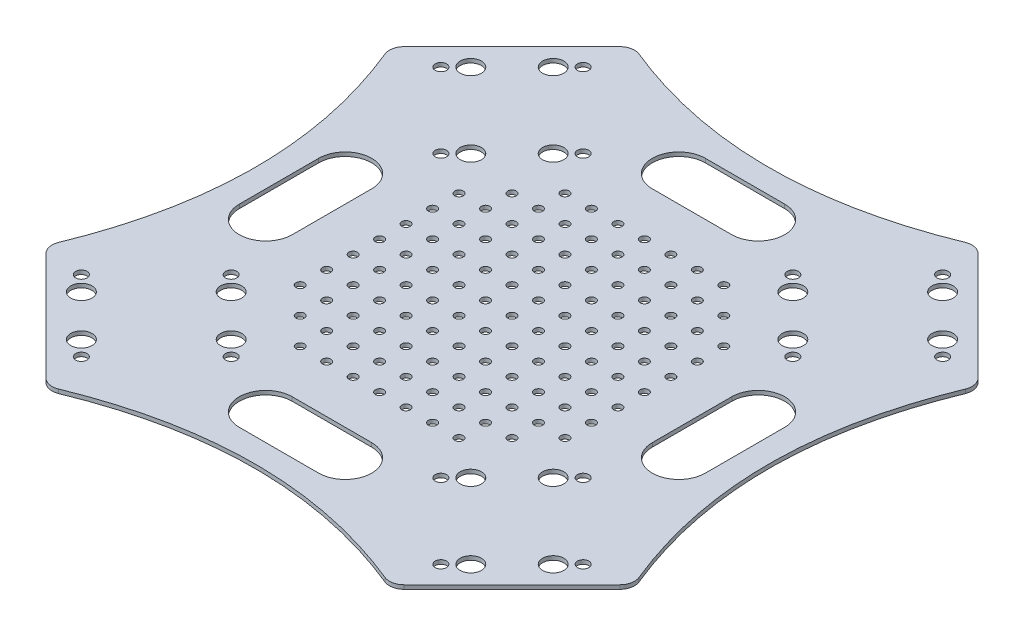
from build123d import *

# Parameters (mm, degrees)
DODANIE_WYCI_GNI_CIE1_DEPTH       = 1.5
ZAOKR_GLENIE1_R                   = 5.5
SZKIC2_R                          = 2.15
SZKIC2_R_2                        = 4
WYTNIJ_WYCI_GNI_CIE1_DEPTH        = 156.56996864
SZYK_KO_OWY1_COUNT                = 4
WYTNIJ_WYCI_GNI_CIE2_REACH        = 157.57
SZYK_KO_OWY2_COUNT                = 4
WYTNIJ_WYCI_GNI_CIE3_REACH        = 157.57
SZKIC4_R                          = 1.6
SZYK_LINIOWY1_COUNT               = 5
SZYK_LINIOWY1_PITCH               = 10
SZYK_LINIOWY1_COUNT_DIR2          = 5
SZYK_LINIOWY1_PITCH_DIR2          = 10
SZYK_KO_OWY3_OUTLINE_R            = 1.6
SZYK_KO_OWY3_DEPTH                = 1.5
SZYK_LINIOWY2_COUNT               = 2
SZYK_LINIOWY2_PITCH               = 50
SZYK_LINIOWY3_COPY_1_REACH        = 157.57
SZYK_LINIOWY3_COPY_1_SKETCH_R     = 1.6
SZYK_LINIOWY3_COPY_2_REACH        = 157.57
SZYK_LINIOWY3_COPY_2_SKETCH_R     = 1.6
SZYK_LINIOWY3_COPY_3_REACH        = 157.57
SZYK_LINIOWY3_COPY_3_SKETCH_R     = 1.6
SZYK_LINIOWY3_COL_COPY_1_REACH    = 157.57
SZYK_LINIOWY3_COL_COPY_1_SKETCH_R = 1.6
SZYK_LINIOWY3_COL_COPY_2_REACH    = 157.57
SZYK_LINIOWY3_COL_COPY_2_SKETCH_R = 1.6
SZYK_LINIOWY3_COL_COPY_3_REACH    = 157.57
SZYK_LINIOWY3_COL_COPY_3_SKETCH_R = 1.6
SZYK_KO_OWY4_COPY_1_REACH         = 157.57
SZYK_KO_OWY4_COPY_1_SKETCH_R      = 1.6
SZYK_KO_OWY4_COPY_2_REACH         = 157.57
SZYK_KO_OWY4_COPY_2_SKETCH_R      = 1.6
SZYK_KO_OWY4_COPY_3_REACH         = 157.57
SZYK_KO_OWY4_COPY_3_SKETCH_R      = 1.6
SZYK_KO_OWY4_COPY_4_REACH         = 157.57
SZYK_KO_OWY4_COPY_4_SKETCH_R      = 1.6
SZYK_KO_OWY4_COPY_5_REACH         = 157.57
SZYK_KO_OWY4_COPY_5_SKETCH_R      = 1.6
SZYK_KO_OWY4_COPY_6_REACH         = 157.57
SZYK_KO_OWY4_COPY_6_SKETCH_R      = 1.6
SZYK_KO_OWY4_COPY_7_REACH         = 157.57
SZYK_KO_OWY4_COPY_7_SKETCH_R      = 1.6
SZYK_KO_OWY4_COPY_8_REACH         = 157.57
SZYK_KO_OWY4_COPY_8_SKETCH_R      = 1.6
SZYK_KO_OWY4_COPY_9_REACH         = 157.57
SZYK_KO_OWY4_COPY_9_SKETCH_R      = 1.6
SZYK_KO_OWY4_COPY_10_REACH        = 157.57
SZYK_KO_OWY4_COPY_10_SKETCH_R     = 1.6
SZYK_KO_OWY4_COPY_11_REACH        = 157.57
SZYK_KO_OWY4_COPY_11_SKETCH_R     = 1.6
SZYK_KO_OWY4_COPY_12_REACH        = 157.57
SZYK_KO_OWY4_COPY_12_SKETCH_R     = 1.6
SZYK_KO_OWY4_COPY_13_REACH        = 157.57
SZYK_KO_OWY4_COPY_13_SKETCH_R     = 1.6
SZYK_KO_OWY4_COPY_14_REACH        = 157.57
SZYK_KO_OWY4_COPY_14_SKETCH_R     = 1.6
SZYK_KO_OWY4_COPY_15_REACH        = 157.57
SZYK_KO_OWY4_COPY_15_SKETCH_R     = 1.6
SZYK_KO_OWY4_COPY_16_REACH        = 157.57
SZYK_KO_OWY4_COPY_16_SKETCH_R     = 1.6
SZYK_KO_OWY4_COPY_17_REACH        = 157.57
SZYK_KO_OWY4_COPY_17_SKETCH_R     = 1.6
SZYK_KO_OWY4_COPY_18_REACH        = 157.57
SZYK_KO_OWY4_COPY_18_SKETCH_R     = 1.6
SZYK_KO_OWY4_COPY_19_REACH        = 157.57
SZYK_KO_OWY4_COPY_19_SKETCH_R     = 1.6
SZYK_KO_OWY4_COPY_20_REACH        = 157.57
SZYK_KO_OWY4_COPY_20_SKETCH_R     = 1.6
SZYK_KO_OWY4_COPY_21_REACH        = 157.57
SZYK_KO_OWY4_COPY_21_SKETCH_R     = 1.6


# Read off the part's stored shape, not the designer's step: Szyk kołowy3
with BuildPart() as part:
    # Szkic1 → Dodanie-wyciągnięcie1 (new body)
    with BuildSketch(Plane(origin=(0, 0, 0), x_dir=(1, 0, 0), z_dir=(0, 1, 0))):
        with BuildLine():
            Line((-65, -111), (-111, -65))
            add(Edge.make_bspline(
                [(-111, 65), (-83, 0), (-111, -65)],
                knots=[0, 0, 0, 1, 1, 1], degree=2))
            Line((-111, 65), (-65, 111))
            add(Edge.make_bspline(
                [(65, 111), (0, 83), (-65, 111)],
                knots=[0, 0, 0, 1, 1, 1], degree=2))
            Line((65, 111), (111, 65))
            add(Edge.make_bspline(
                [(111, -65), (83, 0), (111, 65)],
                knots=[0, 0, 0, 1, 1, 1], degree=2))
            Line((111, -65), (65, -111))
            add(Edge.make_bspline(
                [(-65, -111), (0, -83), (65, -111)],
                knots=[0, 0, 0, 1, 1, 1], degree=2))
        make_face()
    extrude(amount=DODANIE_WYCI_GNI_CIE1_DEPTH)

    # Zaokrąglenie1
    zaokr_glenie1_edges = [part.edges().sort_by_distance(p)[0] for p in [
        (-111, 0.75, -65),
        (-65, 0.75, -111),
        (65, 0.75, -111),
        (111, 0.75, -65),
        (111, 0.75, 65),
        (65, 0.75, 111),
        (-111, 0.75, 65),
        (-65, 0.75, 111),
    ]]
    fillet(zaokr_glenie1_edges, radius=ZAOKR_GLENIE1_R)

    # Szkic2 → Wytnij-wyciągnięcie1 (cut, through all)
    with BuildSketch(Plane(origin=(0, 1.5, 0), x_dir=(1, 0, 0), z_dir=(0, 1, 0))):
        with Locations(Location((-67.882250994, -94.752308679, 0), (0, 0, 270))):
            Circle(SZKIC2_R)
        with Locations(Location((-94.752308679, -67.882250994, 0), (0, 0, 90))):
            Circle(SZKIC2_R)
        with Locations(Location((-39.597979746, -66.468037432, 0), (0, 0, 90))):
            Circle(SZKIC2_R)
        with Locations(Location((-66.468037432, -39.597979746, 0), (0, 0, 270))):
            Circle(SZKIC2_R)
        with Locations(Location((-73.539105243, -89.09545443, 0), (0, 0, 270))):
            Circle(SZKIC2_R_2)
        with Locations(Location((-89.09545443, -73.539105243, 0), (0, 0, 90))):
            Circle(SZKIC2_R_2)
        with Locations(Location((-60.811183182, -45.254833996, 0), (0, 0, 270))):
            Circle(SZKIC2_R_2)
        with Locations(Location((-45.254833996, -60.811183182, 0), (0, 0, 90))):
            Circle(SZKIC2_R_2)
    wytnij_wyci_gni_cie1 = extrude(amount=-WYTNIJ_WYCI_GNI_CIE1_DEPTH, mode=Mode.SUBTRACT)

    # Szyk kołowy1: Wytnij-wyciągnięcie1 ×4 about axis
    szyk_ko_owy1_axis = Axis((0, 0, 0), (0, 1, 0))
    for i in range(1, SZYK_KO_OWY1_COUNT):
        add(wytnij_wyci_gni_cie1.rotate(szyk_ko_owy1_axis, i * 360 / SZYK_KO_OWY1_COUNT), mode=Mode.SUBTRACT)

    # Szkic3 → Wytnij-wyciągnięcie2 (cut, up to next)
    with BuildSketch(Plane(origin=(0, 1.5, 0), x_dir=(1, 0, 0), z_dir=(0, 1, 0)), mode=Mode.PRIVATE) as wytnij_wyci_gni_cie2_sk1:
        with BuildLine():
            Line((-15, 88), (15, 88))
            ThreePointArc((15, 88), (25, 78), (15, 68))
            Line((15, 68), (-15, 68))
            ThreePointArc((-15, 68), (-25, 78), (-15, 88))
        make_face()
    wytnij_wyci_gni_cie2_tool1 = extrude(wytnij_wyci_gni_cie2_sk1.sketch, amount=-WYTNIJ_WYCI_GNI_CIE2_REACH, mode=Mode.PRIVATE) & part.part
    wytnij_wyci_gni_cie2 = wytnij_wyci_gni_cie2_tool1.solids().sort_by_distance((0, 1.5, -78))[0]
    add(wytnij_wyci_gni_cie2, mode=Mode.SUBTRACT)

    # Szyk kołowy2: Wytnij-wyciągnięcie2 ×4 about axis
    szyk_ko_owy2_axis = Axis((0, 0, 0), (0, 1, 0))
    for i in range(1, SZYK_KO_OWY2_COUNT):
        add(wytnij_wyci_gni_cie2.rotate(szyk_ko_owy2_axis, i * 360 / SZYK_KO_OWY2_COUNT), mode=Mode.SUBTRACT)

    # Szkic4 → Wytnij-wyciągnięcie3 (cut, up to next)
    with BuildSketch(Plane(origin=(0, 1.5, 0), x_dir=(1, 0, 0), z_dir=(0, 1, 0)), mode=Mode.PRIVATE) as wytnij_wyci_gni_cie3_sk1:
        with Locations(Location((0, 0, 0), (0, 0, 270))):
            Circle(SZKIC4_R)
    wytnij_wyci_gni_cie3_tool1 = extrude(wytnij_wyci_gni_cie3_sk1.sketch, amount=-WYTNIJ_WYCI_GNI_CIE3_REACH, mode=Mode.PRIVATE) & part.part
    wytnij_wyci_gni_cie3 = wytnij_wyci_gni_cie3_tool1.solids().sort_by_distance((0, 1.5, 0))[0]
    add(wytnij_wyci_gni_cie3, mode=Mode.SUBTRACT)

    # Szyk liniowy1: Wytnij-wyci_gni_cie3 5 × 5
    with Locations(*[(i * SZYK_LINIOWY1_PITCH, 0, j * SZYK_LINIOWY1_PITCH_DIR2) for i in range(SZYK_LINIOWY1_COUNT) for j in range(SZYK_LINIOWY1_COUNT_DIR2) if (i, j) != (0, 0)]):
        add(wytnij_wyci_gni_cie3, mode=Mode.SUBTRACT)

    # Szyk kołowy3 outline → Szyk kołowy3 (cut)
    with BuildSketch(Plane(origin=(0, 0, 0), x_dir=(1, 0, 0), z_dir=(0, 1, 0))):
        with Locations((0, 40)):
            Circle(SZYK_KO_OWY3_OUTLINE_R)
        with Locations((40, 30)):
            Circle(SZYK_KO_OWY3_OUTLINE_R)
        with Locations((30, 30)):
            Circle(SZYK_KO_OWY3_OUTLINE_R)
        with Locations((20, 30)):
            Circle(SZYK_KO_OWY3_OUTLINE_R)
        with Locations((10, 40)):
            Circle(SZYK_KO_OWY3_OUTLINE_R)
        with Locations((20, 40)):
            Circle(SZYK_KO_OWY3_OUTLINE_R)
        with Locations((30, 40)):
            Circle(SZYK_KO_OWY3_OUTLINE_R)
        with Locations((40, 40)):
            Circle(SZYK_KO_OWY3_OUTLINE_R)
        with Locations((0, 10)):
            Circle(SZYK_KO_OWY3_OUTLINE_R)
        with Locations((10, 10)):
            Circle(SZYK_KO_OWY3_OUTLINE_R)
        with Locations((20, 10)):
            Circle(SZYK_KO_OWY3_OUTLINE_R)
        with Locations((30, 10)):
            Circle(SZYK_KO_OWY3_OUTLINE_R)
        with Locations((10, 30)):
            Circle(SZYK_KO_OWY3_OUTLINE_R)
        with Locations((0, 30)):
            Circle(SZYK_KO_OWY3_OUTLINE_R)
        with Locations((40, 20)):
            Circle(SZYK_KO_OWY3_OUTLINE_R)
        with Locations((30, 20)):
            Circle(SZYK_KO_OWY3_OUTLINE_R)
        with Locations((40, 10)):
            Circle(SZYK_KO_OWY3_OUTLINE_R)
        with Locations((0, 20)):
            Circle(SZYK_KO_OWY3_OUTLINE_R)
        with Locations((10, 20)):
            Circle(SZYK_KO_OWY3_OUTLINE_R)
        with Locations((20, 20)):
            Circle(SZYK_KO_OWY3_OUTLINE_R)
        with Locations((-40, 0)):
            Circle(SZYK_KO_OWY3_OUTLINE_R)
        with Locations((-30, 40)):
            Circle(SZYK_KO_OWY3_OUTLINE_R)
        with Locations((-30, 30)):
            Circle(SZYK_KO_OWY3_OUTLINE_R)
        with Locations((-30, 20)):
            Circle(SZYK_KO_OWY3_OUTLINE_R)
        with Locations((-40, 10)):
            Circle(SZYK_KO_OWY3_OUTLINE_R)
        with Locations((-40, 20)):
            Circle(SZYK_KO_OWY3_OUTLINE_R)
        with Locations((-40, 30)):
            Circle(SZYK_KO_OWY3_OUTLINE_R)
        with Locations((-40, 40)):
            Circle(SZYK_KO_OWY3_OUTLINE_R)
        with Locations((-10, 0)):
            Circle(SZYK_KO_OWY3_OUTLINE_R)
        with Locations((-10, 10)):
            Circle(SZYK_KO_OWY3_OUTLINE_R)
        with Locations((-10, 20)):
            Circle(SZYK_KO_OWY3_OUTLINE_R)
        with Locations((-10, 30)):
            Circle(SZYK_KO_OWY3_OUTLINE_R)
        with Locations((-30, 10)):
            Circle(SZYK_KO_OWY3_OUTLINE_R)
        with Locations((-30, 0)):
            Circle(SZYK_KO_OWY3_OUTLINE_R)
        with Locations((-20, 40)):
            Circle(SZYK_KO_OWY3_OUTLINE_R)
        with Locations((-20, 30)):
            Circle(SZYK_KO_OWY3_OUTLINE_R)
        with Locations((-10, 40)):
            Circle(SZYK_KO_OWY3_OUTLINE_R)
        with Locations((-20, 0)):
            Circle(SZYK_KO_OWY3_OUTLINE_R)
        with Locations((-20, 10)):
            Circle(SZYK_KO_OWY3_OUTLINE_R)
        with Locations((-20, 20)):
            Circle(SZYK_KO_OWY3_OUTLINE_R)
        with Locations((-40, -30)):
            Circle(SZYK_KO_OWY3_OUTLINE_R)
        with Locations((-30, -30)):
            Circle(SZYK_KO_OWY3_OUTLINE_R)
        with Locations((-20, -30)):
            Circle(SZYK_KO_OWY3_OUTLINE_R)
        with Locations((-10, -40)):
            Circle(SZYK_KO_OWY3_OUTLINE_R)
        with Locations((-20, -40)):
            Circle(SZYK_KO_OWY3_OUTLINE_R)
        with Locations((-30, -40)):
            Circle(SZYK_KO_OWY3_OUTLINE_R)
        with Locations((-40, -40)):
            Circle(SZYK_KO_OWY3_OUTLINE_R)
        with Locations((-10, -10)):
            Circle(SZYK_KO_OWY3_OUTLINE_R)
        with Locations((-20, -10)):
            Circle(SZYK_KO_OWY3_OUTLINE_R)
        with Locations((-30, -10)):
            Circle(SZYK_KO_OWY3_OUTLINE_R)
        with Locations((-10, -30)):
            Circle(SZYK_KO_OWY3_OUTLINE_R)
        with Locations((-40, -20)):
            Circle(SZYK_KO_OWY3_OUTLINE_R)
        with Locations((-30, -20)):
            Circle(SZYK_KO_OWY3_OUTLINE_R)
        with Locations((-40, -10)):
            Circle(SZYK_KO_OWY3_OUTLINE_R)
        with Locations((-10, -20)):
            Circle(SZYK_KO_OWY3_OUTLINE_R)
        with Locations((-20, -20)):
            Circle(SZYK_KO_OWY3_OUTLINE_R)
    extrude(amount=SZYK_KO_OWY3_DEPTH, mode=Mode.SUBTRACT)

    # Szyk liniowy2: Wytnij-wyciągnięcie3 ×2
    with Locations(*[(0, 0, i * SZYK_LINIOWY2_PITCH) for i in range(1, SZYK_LINIOWY2_COUNT)]):
        add(wytnij_wyci_gni_cie3, mode=Mode.SUBTRACT)

    # Szyk liniowy3 copy 1 sketch → Szyk liniowy3 copy 1 (cut, up to next)
    with BuildSketch(Plane(origin=(10, 1.5, 50), x_dir=(1, 0, 0), z_dir=(0, 1, 0)), mode=Mode.PRIVATE) as szyk_liniowy3_copy_1_sk1:
        with Locations(Location((0, 0, 0), (0, 0, 270))):
            Circle(SZYK_LINIOWY3_COPY_1_SKETCH_R)
    szyk_liniowy3_copy_1_tool1 = extrude(szyk_liniowy3_copy_1_sk1.sketch, amount=-SZYK_LINIOWY3_COPY_1_REACH, mode=Mode.PRIVATE) & part.part
    add(szyk_liniowy3_copy_1_tool1.solids().sort_by_distance((10, 1.5, 50))[0], mode=Mode.SUBTRACT)

    # Szyk liniowy3 copy 2 sketch → Szyk liniowy3 copy 2 (cut, up to next)
    with BuildSketch(Plane(origin=(20, 1.5, 50), x_dir=(1, 0, 0), z_dir=(0, 1, 0)), mode=Mode.PRIVATE) as szyk_liniowy3_copy_2_sk1:
        with Locations(Location((0, 0, 0), (0, 0, 270))):
            Circle(SZYK_LINIOWY3_COPY_2_SKETCH_R)
    szyk_liniowy3_copy_2_tool1 = extrude(szyk_liniowy3_copy_2_sk1.sketch, amount=-SZYK_LINIOWY3_COPY_2_REACH, mode=Mode.PRIVATE) & part.part
    add(szyk_liniowy3_copy_2_tool1.solids().sort_by_distance((20, 1.5, 50))[0], mode=Mode.SUBTRACT)

    # Szyk liniowy3 copy 3 sketch → Szyk liniowy3 copy 3 (cut, up to next)
    with BuildSketch(Plane(origin=(30, 1.5, 50), x_dir=(1, 0, 0), z_dir=(0, 1, 0)), mode=Mode.PRIVATE) as szyk_liniowy3_copy_3_sk1:
        with Locations(Location((0, 0, 0), (0, 0, 270))):
            Circle(SZYK_LINIOWY3_COPY_3_SKETCH_R)
    szyk_liniowy3_copy_3_tool1 = extrude(szyk_liniowy3_copy_3_sk1.sketch, amount=-SZYK_LINIOWY3_COPY_3_REACH, mode=Mode.PRIVATE) & part.part
    add(szyk_liniowy3_copy_3_tool1.solids().sort_by_distance((30, 1.5, 50))[0], mode=Mode.SUBTRACT)

    # Szyk liniowy3 col copy 1 sketch → Szyk liniowy3 col copy 1 (cut, up to next)
    with BuildSketch(Plane(origin=(-10, 1.5, 50), x_dir=(1, 0, 0), z_dir=(0, 1, 0)), mode=Mode.PRIVATE) as szyk_liniowy3_col_copy_1_sk1:
        with Locations(Location((0, 0, 0), (0, 0, 270))):
            Circle(SZYK_LINIOWY3_COL_COPY_1_SKETCH_R)
    szyk_liniowy3_col_copy_1_tool1 = extrude(szyk_liniowy3_col_copy_1_sk1.sketch, amount=-SZYK_LINIOWY3_COL_COPY_1_REACH, mode=Mode.PRIVATE) & part.part
    add(szyk_liniowy3_col_copy_1_tool1.solids().sort_by_distance((-10, 1.5, 50))[0], mode=Mode.SUBTRACT)

    # Szyk liniowy3 col copy 2 sketch → Szyk liniowy3 col copy 2 (cut, up to next)
    with BuildSketch(Plane(origin=(-20, 1.5, 50), x_dir=(1, 0, 0), z_dir=(0, 1, 0)), mode=Mode.PRIVATE) as szyk_liniowy3_col_copy_2_sk1:
        with Locations(Location((0, 0, 0), (0, 0, 270))):
            Circle(SZYK_LINIOWY3_COL_COPY_2_SKETCH_R)
    szyk_liniowy3_col_copy_2_tool1 = extrude(szyk_liniowy3_col_copy_2_sk1.sketch, amount=-SZYK_LINIOWY3_COL_COPY_2_REACH, mode=Mode.PRIVATE) & part.part
    add(szyk_liniowy3_col_copy_2_tool1.solids().sort_by_distance((-20, 1.5, 50))[0], mode=Mode.SUBTRACT)

    # Szyk liniowy3 col copy 3 sketch → Szyk liniowy3 col copy 3 (cut, up to next)
    with BuildSketch(Plane(origin=(-30, 1.5, 50), x_dir=(1, 0, 0), z_dir=(0, 1, 0)), mode=Mode.PRIVATE) as szyk_liniowy3_col_copy_3_sk1:
        with Locations(Location((0, 0, 0), (0, 0, 270))):
            Circle(SZYK_LINIOWY3_COL_COPY_3_SKETCH_R)
    szyk_liniowy3_col_copy_3_tool1 = extrude(szyk_liniowy3_col_copy_3_sk1.sketch, amount=-SZYK_LINIOWY3_COL_COPY_3_REACH, mode=Mode.PRIVATE) & part.part
    add(szyk_liniowy3_col_copy_3_tool1.solids().sort_by_distance((-30, 1.5, 50))[0], mode=Mode.SUBTRACT)

    # Szyk kołowy4 copy 1 sketch → Szyk kołowy4 copy 1 (cut, up to next)
    with BuildSketch(Plane(origin=(50, 1.5, 0), x_dir=(0, 0, -1), z_dir=(0, 1, 0)), mode=Mode.PRIVATE) as szyk_ko_owy4_copy_1_sk1:
        with Locations(Location((0, 0, 0), (0, 0, 270))):
            Circle(SZYK_KO_OWY4_COPY_1_SKETCH_R)
    szyk_ko_owy4_copy_1_tool1 = extrude(szyk_ko_owy4_copy_1_sk1.sketch, amount=-SZYK_KO_OWY4_COPY_1_REACH, mode=Mode.PRIVATE) & part.part
    add(szyk_ko_owy4_copy_1_tool1.solids().sort_by_distance((50, 1.5, 0))[0], mode=Mode.SUBTRACT)

    # Szyk kołowy4 copy 2 sketch → Szyk kołowy4 copy 2 (cut, up to next)
    with BuildSketch(Plane(origin=(0, 1.5, -50), x_dir=(-1, 0, 0), z_dir=(0, 1, 0)), mode=Mode.PRIVATE) as szyk_ko_owy4_copy_2_sk1:
        with Locations(Location((0, 0, 0), (0, 0, 270))):
            Circle(SZYK_KO_OWY4_COPY_2_SKETCH_R)
    szyk_ko_owy4_copy_2_tool1 = extrude(szyk_ko_owy4_copy_2_sk1.sketch, amount=-SZYK_KO_OWY4_COPY_2_REACH, mode=Mode.PRIVATE) & part.part
    add(szyk_ko_owy4_copy_2_tool1.solids().sort_by_distance((0, 1.5, -50))[0], mode=Mode.SUBTRACT)

    # Szyk kołowy4 copy 3 sketch → Szyk kołowy4 copy 3 (cut, up to next)
    with BuildSketch(Plane(origin=(-50, 1.5, 0), x_dir=(0, 0, 1), z_dir=(0, 1, 0)), mode=Mode.PRIVATE) as szyk_ko_owy4_copy_3_sk1:
        with Locations(Location((0, 0, 0), (0, 0, 270))):
            Circle(SZYK_KO_OWY4_COPY_3_SKETCH_R)
    szyk_ko_owy4_copy_3_tool1 = extrude(szyk_ko_owy4_copy_3_sk1.sketch, amount=-SZYK_KO_OWY4_COPY_3_REACH, mode=Mode.PRIVATE) & part.part
    add(szyk_ko_owy4_copy_3_tool1.solids().sort_by_distance((-50, 1.5, 0))[0], mode=Mode.SUBTRACT)

    # Szyk kołowy4 copy 4 sketch → Szyk kołowy4 copy 4 (cut, up to next)
    with BuildSketch(Plane(origin=(50, 1.5, -10), x_dir=(0, 0, -1), z_dir=(0, 1, 0)), mode=Mode.PRIVATE) as szyk_ko_owy4_copy_4_sk1:
        with Locations(Location((0, 0, 0), (0, 0, 270))):
            Circle(SZYK_KO_OWY4_COPY_4_SKETCH_R)
    szyk_ko_owy4_copy_4_tool1 = extrude(szyk_ko_owy4_copy_4_sk1.sketch, amount=-SZYK_KO_OWY4_COPY_4_REACH, mode=Mode.PRIVATE) & part.part
    add(szyk_ko_owy4_copy_4_tool1.solids().sort_by_distance((50, 1.5, -10))[0], mode=Mode.SUBTRACT)

    # Szyk kołowy4 copy 5 sketch → Szyk kołowy4 copy 5 (cut, up to next)
    with BuildSketch(Plane(origin=(-10, 1.5, -50), x_dir=(-1, 0, 0), z_dir=(0, 1, 0)), mode=Mode.PRIVATE) as szyk_ko_owy4_copy_5_sk1:
        with Locations(Location((0, 0, 0), (0, 0, 270))):
            Circle(SZYK_KO_OWY4_COPY_5_SKETCH_R)
    szyk_ko_owy4_copy_5_tool1 = extrude(szyk_ko_owy4_copy_5_sk1.sketch, amount=-SZYK_KO_OWY4_COPY_5_REACH, mode=Mode.PRIVATE) & part.part
    add(szyk_ko_owy4_copy_5_tool1.solids().sort_by_distance((-10, 1.5, -50))[0], mode=Mode.SUBTRACT)

    # Szyk kołowy4 copy 6 sketch → Szyk kołowy4 copy 6 (cut, up to next)
    with BuildSketch(Plane(origin=(-50, 1.5, 10), x_dir=(0, 0, 1), z_dir=(0, 1, 0)), mode=Mode.PRIVATE) as szyk_ko_owy4_copy_6_sk1:
        with Locations(Location((0, 0, 0), (0, 0, 270))):
            Circle(SZYK_KO_OWY4_COPY_6_SKETCH_R)
    szyk_ko_owy4_copy_6_tool1 = extrude(szyk_ko_owy4_copy_6_sk1.sketch, amount=-SZYK_KO_OWY4_COPY_6_REACH, mode=Mode.PRIVATE) & part.part
    add(szyk_ko_owy4_copy_6_tool1.solids().sort_by_distance((-50, 1.5, 10))[0], mode=Mode.SUBTRACT)

    # Szyk kołowy4 copy 7 sketch → Szyk kołowy4 copy 7 (cut, up to next)
    with BuildSketch(Plane(origin=(50, 1.5, -20), x_dir=(0, 0, -1), z_dir=(0, 1, 0)), mode=Mode.PRIVATE) as szyk_ko_owy4_copy_7_sk1:
        with Locations(Location((0, 0, 0), (0, 0, 270))):
            Circle(SZYK_KO_OWY4_COPY_7_SKETCH_R)
    szyk_ko_owy4_copy_7_tool1 = extrude(szyk_ko_owy4_copy_7_sk1.sketch, amount=-SZYK_KO_OWY4_COPY_7_REACH, mode=Mode.PRIVATE) & part.part
    add(szyk_ko_owy4_copy_7_tool1.solids().sort_by_distance((50, 1.5, -20))[0], mode=Mode.SUBTRACT)

    # Szyk kołowy4 copy 8 sketch → Szyk kołowy4 copy 8 (cut, up to next)
    with BuildSketch(Plane(origin=(-20, 1.5, -50), x_dir=(-1, 0, 0), z_dir=(0, 1, 0)), mode=Mode.PRIVATE) as szyk_ko_owy4_copy_8_sk1:
        with Locations(Location((0, 0, 0), (0, 0, 270))):
            Circle(SZYK_KO_OWY4_COPY_8_SKETCH_R)
    szyk_ko_owy4_copy_8_tool1 = extrude(szyk_ko_owy4_copy_8_sk1.sketch, amount=-SZYK_KO_OWY4_COPY_8_REACH, mode=Mode.PRIVATE) & part.part
    add(szyk_ko_owy4_copy_8_tool1.solids().sort_by_distance((-20, 1.5, -50))[0], mode=Mode.SUBTRACT)

    # Szyk kołowy4 copy 9 sketch → Szyk kołowy4 copy 9 (cut, up to next)
    with BuildSketch(Plane(origin=(-50, 1.5, 20), x_dir=(0, 0, 1), z_dir=(0, 1, 0)), mode=Mode.PRIVATE) as szyk_ko_owy4_copy_9_sk1:
        with Locations(Location((0, 0, 0), (0, 0, 270))):
            Circle(SZYK_KO_OWY4_COPY_9_SKETCH_R)
    szyk_ko_owy4_copy_9_tool1 = extrude(szyk_ko_owy4_copy_9_sk1.sketch, amount=-SZYK_KO_OWY4_COPY_9_REACH, mode=Mode.PRIVATE) & part.part
    add(szyk_ko_owy4_copy_9_tool1.solids().sort_by_distance((-50, 1.5, 20))[0], mode=Mode.SUBTRACT)

    # Szyk kołowy4 copy 10 sketch → Szyk kołowy4 copy 10 (cut, up to next)
    with BuildSketch(Plane(origin=(50, 1.5, -30), x_dir=(0, 0, -1), z_dir=(0, 1, 0)), mode=Mode.PRIVATE) as szyk_ko_owy4_copy_10_sk1:
        with Locations(Location((0, 0, 0), (0, 0, 270))):
            Circle(SZYK_KO_OWY4_COPY_10_SKETCH_R)
    szyk_ko_owy4_copy_10_tool1 = extrude(szyk_ko_owy4_copy_10_sk1.sketch, amount=-SZYK_KO_OWY4_COPY_10_REACH, mode=Mode.PRIVATE) & part.part
    add(szyk_ko_owy4_copy_10_tool1.solids().sort_by_distance((50, 1.5, -30))[0], mode=Mode.SUBTRACT)

    # Szyk kołowy4 copy 11 sketch → Szyk kołowy4 copy 11 (cut, up to next)
    with BuildSketch(Plane(origin=(-30, 1.5, -50), x_dir=(-1, 0, 0), z_dir=(0, 1, 0)), mode=Mode.PRIVATE) as szyk_ko_owy4_copy_11_sk1:
        with Locations(Location((0, 0, 0), (0, 0, 270))):
            Circle(SZYK_KO_OWY4_COPY_11_SKETCH_R)
    szyk_ko_owy4_copy_11_tool1 = extrude(szyk_ko_owy4_copy_11_sk1.sketch, amount=-SZYK_KO_OWY4_COPY_11_REACH, mode=Mode.PRIVATE) & part.part
    add(szyk_ko_owy4_copy_11_tool1.solids().sort_by_distance((-30, 1.5, -50))[0], mode=Mode.SUBTRACT)

    # Szyk kołowy4 copy 12 sketch → Szyk kołowy4 copy 12 (cut, up to next)
    with BuildSketch(Plane(origin=(-50, 1.5, 30), x_dir=(0, 0, 1), z_dir=(0, 1, 0)), mode=Mode.PRIVATE) as szyk_ko_owy4_copy_12_sk1:
        with Locations(Location((0, 0, 0), (0, 0, 270))):
            Circle(SZYK_KO_OWY4_COPY_12_SKETCH_R)
    szyk_ko_owy4_copy_12_tool1 = extrude(szyk_ko_owy4_copy_12_sk1.sketch, amount=-SZYK_KO_OWY4_COPY_12_REACH, mode=Mode.PRIVATE) & part.part
    add(szyk_ko_owy4_copy_12_tool1.solids().sort_by_distance((-50, 1.5, 30))[0], mode=Mode.SUBTRACT)

    # Szyk kołowy4 copy 13 sketch → Szyk kołowy4 copy 13 (cut, up to next)
    with BuildSketch(Plane(origin=(50, 1.5, 10), x_dir=(0, 0, -1), z_dir=(0, 1, 0)), mode=Mode.PRIVATE) as szyk_ko_owy4_copy_13_sk1:
        with Locations(Location((0, 0, 0), (0, 0, 270))):
            Circle(SZYK_KO_OWY4_COPY_13_SKETCH_R)
    szyk_ko_owy4_copy_13_tool1 = extrude(szyk_ko_owy4_copy_13_sk1.sketch, amount=-SZYK_KO_OWY4_COPY_13_REACH, mode=Mode.PRIVATE) & part.part
    add(szyk_ko_owy4_copy_13_tool1.solids().sort_by_distance((50, 1.5, 10))[0], mode=Mode.SUBTRACT)

    # Szyk kołowy4 copy 14 sketch → Szyk kołowy4 copy 14 (cut, up to next)
    with BuildSketch(Plane(origin=(10, 1.5, -50), x_dir=(-1, 0, 0), z_dir=(0, 1, 0)), mode=Mode.PRIVATE) as szyk_ko_owy4_copy_14_sk1:
        with Locations(Location((0, 0, 0), (0, 0, 270))):
            Circle(SZYK_KO_OWY4_COPY_14_SKETCH_R)
    szyk_ko_owy4_copy_14_tool1 = extrude(szyk_ko_owy4_copy_14_sk1.sketch, amount=-SZYK_KO_OWY4_COPY_14_REACH, mode=Mode.PRIVATE) & part.part
    add(szyk_ko_owy4_copy_14_tool1.solids().sort_by_distance((10, 1.5, -50))[0], mode=Mode.SUBTRACT)

    # Szyk kołowy4 copy 15 sketch → Szyk kołowy4 copy 15 (cut, up to next)
    with BuildSketch(Plane(origin=(-50, 1.5, -10), x_dir=(0, 0, 1), z_dir=(0, 1, 0)), mode=Mode.PRIVATE) as szyk_ko_owy4_copy_15_sk1:
        with Locations(Location((0, 0, 0), (0, 0, 270))):
            Circle(SZYK_KO_OWY4_COPY_15_SKETCH_R)
    szyk_ko_owy4_copy_15_tool1 = extrude(szyk_ko_owy4_copy_15_sk1.sketch, amount=-SZYK_KO_OWY4_COPY_15_REACH, mode=Mode.PRIVATE) & part.part
    add(szyk_ko_owy4_copy_15_tool1.solids().sort_by_distance((-50, 1.5, -10))[0], mode=Mode.SUBTRACT)

    # Szyk kołowy4 copy 16 sketch → Szyk kołowy4 copy 16 (cut, up to next)
    with BuildSketch(Plane(origin=(50, 1.5, 20), x_dir=(0, 0, -1), z_dir=(0, 1, 0)), mode=Mode.PRIVATE) as szyk_ko_owy4_copy_16_sk1:
        with Locations(Location((0, 0, 0), (0, 0, 270))):
            Circle(SZYK_KO_OWY4_COPY_16_SKETCH_R)
    szyk_ko_owy4_copy_16_tool1 = extrude(szyk_ko_owy4_copy_16_sk1.sketch, amount=-SZYK_KO_OWY4_COPY_16_REACH, mode=Mode.PRIVATE) & part.part
    add(szyk_ko_owy4_copy_16_tool1.solids().sort_by_distance((50, 1.5, 20))[0], mode=Mode.SUBTRACT)

    # Szyk kołowy4 copy 17 sketch → Szyk kołowy4 copy 17 (cut, up to next)
    with BuildSketch(Plane(origin=(20, 1.5, -50), x_dir=(-1, 0, 0), z_dir=(0, 1, 0)), mode=Mode.PRIVATE) as szyk_ko_owy4_copy_17_sk1:
        with Locations(Location((0, 0, 0), (0, 0, 270))):
            Circle(SZYK_KO_OWY4_COPY_17_SKETCH_R)
    szyk_ko_owy4_copy_17_tool1 = extrude(szyk_ko_owy4_copy_17_sk1.sketch, amount=-SZYK_KO_OWY4_COPY_17_REACH, mode=Mode.PRIVATE) & part.part
    add(szyk_ko_owy4_copy_17_tool1.solids().sort_by_distance((20, 1.5, -50))[0], mode=Mode.SUBTRACT)

    # Szyk kołowy4 copy 18 sketch → Szyk kołowy4 copy 18 (cut, up to next)
    with BuildSketch(Plane(origin=(-50, 1.5, -20), x_dir=(0, 0, 1), z_dir=(0, 1, 0)), mode=Mode.PRIVATE) as szyk_ko_owy4_copy_18_sk1:
        with Locations(Location((0, 0, 0), (0, 0, 270))):
            Circle(SZYK_KO_OWY4_COPY_18_SKETCH_R)
    szyk_ko_owy4_copy_18_tool1 = extrude(szyk_ko_owy4_copy_18_sk1.sketch, amount=-SZYK_KO_OWY4_COPY_18_REACH, mode=Mode.PRIVATE) & part.part
    add(szyk_ko_owy4_copy_18_tool1.solids().sort_by_distance((-50, 1.5, -20))[0], mode=Mode.SUBTRACT)

    # Szyk kołowy4 copy 19 sketch → Szyk kołowy4 copy 19 (cut, up to next)
    with BuildSketch(Plane(origin=(50, 1.5, 30), x_dir=(0, 0, -1), z_dir=(0, 1, 0)), mode=Mode.PRIVATE) as szyk_ko_owy4_copy_19_sk1:
        with Locations(Location((0, 0, 0), (0, 0, 270))):
            Circle(SZYK_KO_OWY4_COPY_19_SKETCH_R)
    szyk_ko_owy4_copy_19_tool1 = extrude(szyk_ko_owy4_copy_19_sk1.sketch, amount=-SZYK_KO_OWY4_COPY_19_REACH, mode=Mode.PRIVATE) & part.part
    add(szyk_ko_owy4_copy_19_tool1.solids().sort_by_distance((50, 1.5, 30))[0], mode=Mode.SUBTRACT)

    # Szyk kołowy4 copy 20 sketch → Szyk kołowy4 copy 20 (cut, up to next)
    with BuildSketch(Plane(origin=(30, 1.5, -50), x_dir=(-1, 0, 0), z_dir=(0, 1, 0)), mode=Mode.PRIVATE) as szyk_ko_owy4_copy_20_sk1:
        with Locations(Location((0, 0, 0), (0, 0, 270))):
            Circle(SZYK_KO_OWY4_COPY_20_SKETCH_R)
    szyk_ko_owy4_copy_20_tool1 = extrude(szyk_ko_owy4_copy_20_sk1.sketch, amount=-SZYK_KO_OWY4_COPY_20_REACH, mode=Mode.PRIVATE) & part.part
    add(szyk_ko_owy4_copy_20_tool1.solids().sort_by_distance((30, 1.5, -50))[0], mode=Mode.SUBTRACT)

    # Szyk kołowy4 copy 21 sketch → Szyk kołowy4 copy 21 (cut, up to next)
    with BuildSketch(Plane(origin=(-50, 1.5, -30), x_dir=(0, 0, 1), z_dir=(0, 1, 0)), mode=Mode.PRIVATE) as szyk_ko_owy4_copy_21_sk1:
        with Locations(Location((0, 0, 0), (0, 0, 270))):
            Circle(SZYK_KO_OWY4_COPY_21_SKETCH_R)
    szyk_ko_owy4_copy_21_tool1 = extrude(szyk_ko_owy4_copy_21_sk1.sketch, amount=-SZYK_KO_OWY4_COPY_21_REACH, mode=Mode.PRIVATE) & part.part
    add(szyk_ko_owy4_copy_21_tool1.solids().sort_by_distance((-50, 1.5, -30))[0], mode=Mode.SUBTRACT)


solid = part.part
